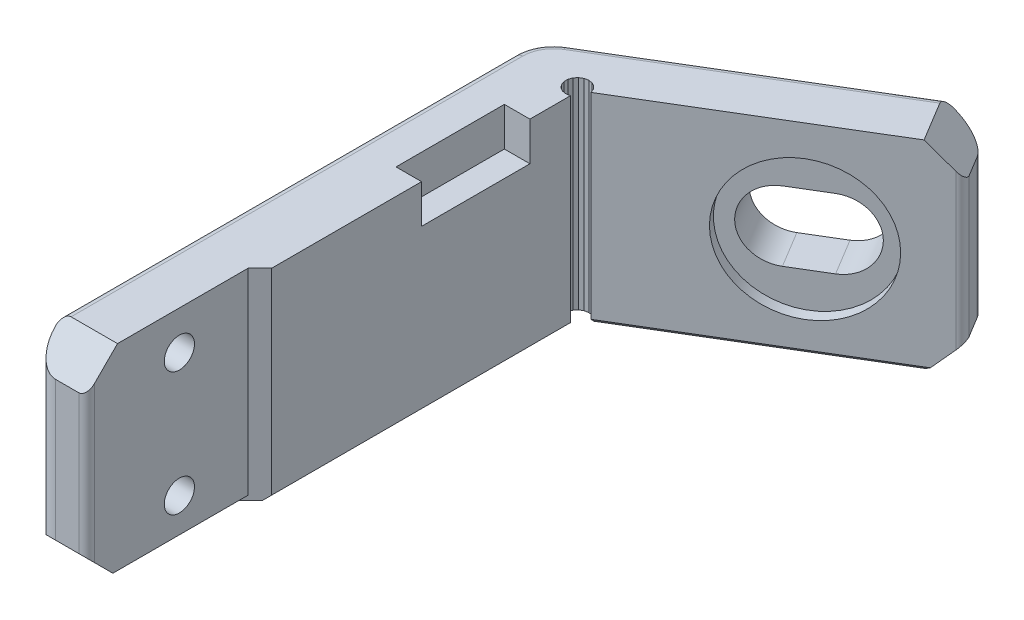
from build123d import *

# Parameters (mm, degrees)
LEG_AND_PAD_DEPTH          = 13
SCREW_HEAD_RELIEF_SKETCH_W = 14
SCREW_HEAD_RELIEF_SKETCH_H = 6
SCREW_HEAD_RELIEF_DEPTH    = 2.35
M6_SLOT_MIDDLE_DEPTH       = 4.5
SCREW_HOLES_SKETCH_R       = 1.95
SCREW_HOLES_DEPTH          = 4.5
LEG_TOP_CORNERS_SIZE       = 4
PAD_END_CORNERS_SIZE       = 4
OUTSIDE_OF_THE_BEND_R      = 5
LEG_TOP_OUTER_EDGE_R       = 3
PAD_END_OUTER_EDGE_R       = 3
LEG_TOP_INNER_EDGE_R       = 1
PAD_END_INNER_EDGE_R       = 1
BED_FACE_CHAMFER_SIZE      = 0.6
TOP_FACE_EDGE_R            = 1


with BuildPart() as part:
    # leg and pad sketch → leg and pad (new, symmetric)
    with BuildSketch(Plane(origin=(0, -20.7, 0), x_dir=(1, 0, 0), z_dir=(0, 1, 0))):
        Polygon((0.551289683, 30.332713936), (0.367250577, 30.819395741), (0.028023026, 31.213926146), (-0.425575667, 31.468833575), (-0.938966578, 31.553446481), (-1.450376329, 31.457583879), (-1.898269923, 31.192780366), (-2.228754897, 30.790898227), (-2.402065893, 30.30029363), (-2.397349395, 29.779998208), (-2.215172912, 29.292616119), (-1.877456693, 28.896791249), (-1.424836191, 28.640150931), (-0.91177263, 28.55357522), (-0.4, 28.647481273), (-0.4, -9.98), (-1.92, -11.5), (-1.92, -32.37), (-8.92, -32.37), (-8.92, 32.792642706), (27.204821487, 54.594667874), (30.821788068, 48.601542416), align=None)
    extrude(amount=LEG_AND_PAD_DEPTH, both=True)

    # screw head relief sketch → screw head relief (cut, symmetric)
    with BuildSketch(Plane(origin=(-1.35, 0, 0), x_dir=(0, 0, -1), z_dir=(1, 0, 0))):
        with Locations((16.4, -9.7)):
            Rectangle(SCREW_HEAD_RELIEF_SKETCH_W, SCREW_HEAD_RELIEF_SKETCH_H)
    extrude(amount=SCREW_HEAD_RELIEF_DEPTH, both=True, mode=Mode.SUBTRACT)

    # insert flange relief sketch → insert flange relief (revolve, cut)
    with BuildSketch(Plane(origin=(0, -20.7, 0), x_dir=(1, 0, 0), z_dir=(0, 1, 0))):
        Polygon((18.324853729, 39.891397061), (17.03307995, 42.03179901), (9.327632933, 37.381413406), (10.619406712, 35.241011457), align=None)
    revolve(axis=Axis((18.324853729, -20.7, -39.891397061), (-0.5167095115681243, 0, -0.8561607796757748)), mode=Mode.SUBTRACT)

    # M6 slot end 1 sketch → M6 slot end 1 (revolve, cut)
    with BuildSketch(Plane(origin=(0, -20.7, 0), x_dir=(1, 0, 0), z_dir=(0, 1, 0))):
        Polygon((20.465255678, 41.18317084), (15.814870074, 48.888617857), (11.962146565, 46.563425055), (16.612532169, 38.857978038), align=None)
    revolve(axis=Axis((20.465255678, -20.7, -41.18317084), (-0.5167095115681236, 0, -0.8561607796757752)), mode=Mode.SUBTRACT)

    # M6 slot end 2 sketch → M6 slot end 2 (revolve, cut)
    with BuildSketch(Plane(origin=(0, -20.7, 0), x_dir=(1, 0, 0), z_dir=(0, 1, 0))):
        Polygon((16.18445178, 38.599623282), (11.534066176, 46.305070299), (7.681342667, 43.979877497), (12.331728271, 36.27443048), align=None)
    revolve(axis=Axis((16.18445178, -20.7, -38.599623282), (-0.5167095115681234, 0, -0.8561607796757752)), mode=Mode.SUBTRACT)

    # M6 slot middle sketch → M6 slot middle (cut, symmetric)
    with BuildSketch(Plane(origin=(0, -20.7, 0), x_dir=(1, 0, 0), z_dir=(0, 1, 0))):
        Polygon((16.18445178, 38.599623282), (20.465255678, 41.18317084), (15.814870074, 48.888617857), (11.534066176, 46.305070299), align=None)
    extrude(amount=M6_SLOT_MIDDLE_DEPTH, both=True, mode=Mode.SUBTRACT)

    # screw holes sketch → screw holes (cut, symmetric)
    with BuildSketch(Plane(origin=(-5.42, 0, 0), x_dir=(0, 0, -1), z_dir=(1, 0, 0))):
        with Locations((-20.375, -28.7)):
            Circle(SCREW_HOLES_SKETCH_R)
        with Locations((-20.375, -12.7)):
            Circle(SCREW_HOLES_SKETCH_R)
    extrude(amount=SCREW_HOLES_DEPTH, both=True, mode=Mode.SUBTRACT)

    # leg top corners
    leg_top_corners_edges = [part.edges().sort_by_distance(p)[0] for p in [
        (-5.42, -7.7, 32.37),
        (-5.42, -33.7, 32.37),
    ]]
    chamfer(leg_top_corners_edges, length=LEG_TOP_CORNERS_SIZE)

    # pad end corners
    pad_end_corners_edges = [part.edges().sort_by_distance(p)[0] for p in [
        (29.013304778, -7.7, -51.598105145),
        (29.013304778, -33.7, -51.598105145),
    ]]
    chamfer(pad_end_corners_edges, length=PAD_END_CORNERS_SIZE)

    # outside of the bend
    outside_of_the_bend_edges = [part.edges().sort_by_distance(p)[0] for p in [
        (-8.92, -20.7, -32.792642706),
    ]]
    fillet(outside_of_the_bend_edges, radius=OUTSIDE_OF_THE_BEND_R)

    # leg top outer edge
    leg_top_outer_edge_edges = [part.edges().sort_by_distance(p)[0] for p in [
        (-8.92, -20.7, 32.37),
    ]]
    fillet(leg_top_outer_edge_edges, radius=LEG_TOP_OUTER_EDGE_R)

    # pad end outer edge
    pad_end_outer_edge_edges = [part.edges().sort_by_distance(p)[0] for p in [
        (27.204821487, -20.7, -54.594667874),
    ]]
    fillet(pad_end_outer_edge_edges, radius=PAD_END_OUTER_EDGE_R)

    # leg top inner edge
    leg_top_inner_edge_edges = [part.edges().sort_by_distance(p)[0] for p in [
        (-1.92, -20.7, 32.37),
    ]]
    fillet(leg_top_inner_edge_edges, radius=LEG_TOP_INNER_EDGE_R)

    # pad end inner edge
    pad_end_inner_edge_edges = [part.edges().sort_by_distance(p)[0] for p in [
        (30.821788068, -20.7, -48.601542416),
    ]]
    fillet(pad_end_inner_edge_edges, radius=PAD_END_INNER_EDGE_R)

    # bed face chamfer
    bed_face_chamfer_edges = [part.edges().sort_by_distance(p)[0] for p in [
        (13.974217317, -33.7, -38.433709153),
        (8.638315405, -33.7, -43.38942405),
        (-1.92, -33.7, 19.935),
        (-0.4, -33.7, -9.333740636),
        (-8.274178326, -33.7, -32.428085628),
        (-8.92, -33.7, -0.800107187),
    ]]
    chamfer(bed_face_chamfer_edges, length=BED_FACE_CHAMFER_SIZE)

    # top face edge
    top_face_edge_edges = [part.edges().sort_by_distance(p)[0] for p in [
        (8.638315405, -7.7, -43.38942405),
        (-8.274178326, -7.7, -32.428085628),
        (-8.92, -7.7, -0.800107187),
    ]]
    fillet(top_face_edge_edges, radius=TOP_FACE_EDGE_R)


solid = part.part
